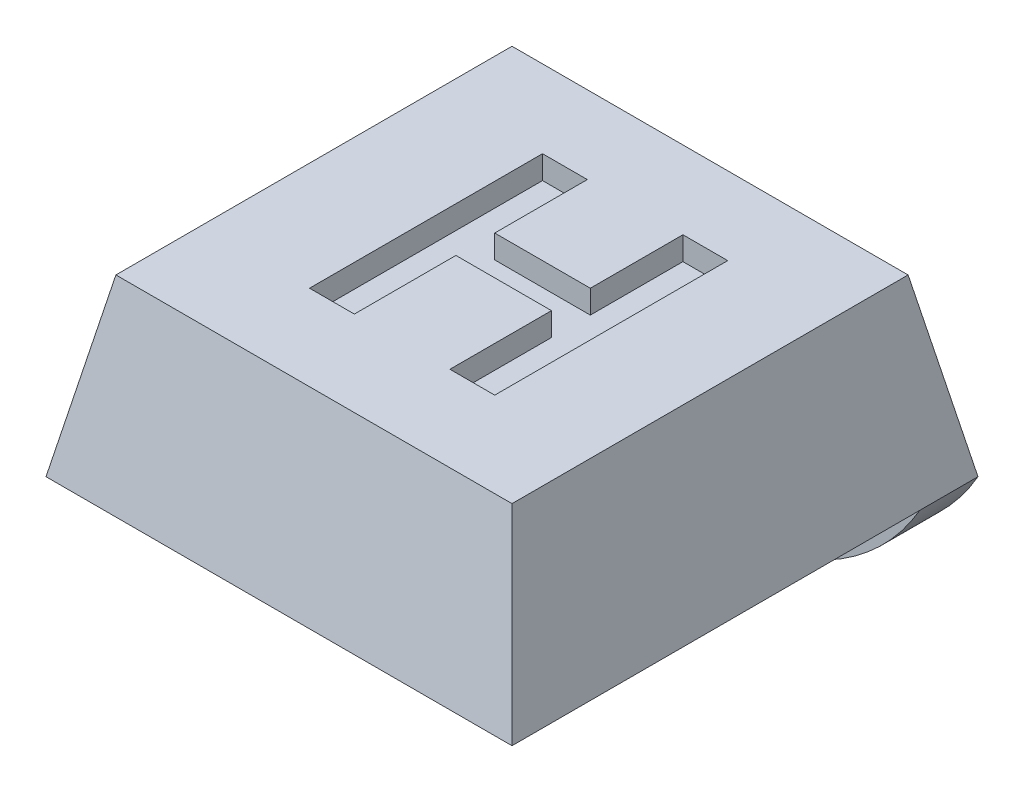
from build123d import *

# Parameters (mm, degrees)
SKETCH1_W               = 8
SKETCH1_H               = 8
BOSS_EXTRUDE1_DEPTH     = 3
CUT_EXTRUDE1_DEPTH      = 12.704699911
CUT_EXTRUDE1_DEPTH_BACK = 12.704699911
CUT_EXTRUDE2_DEPTH      = 11
SKETCH4_R               = 1.8
CUT_EXTRUDE3_DEPTH      = 0.8
SKETCH5_W               = 8
SKETCH5_H               = 1
BOSS_EXTRUDE2_DEPTH     = 2
FILLET1_R               = 4
CUT_EXTRUDE4_DEPTH      = 0.4


with BuildPart() as part:
    # Sketch1 → Boss-Extrude1 (new body)
    with BuildSketch(Plane(origin=(0, 0, 0), x_dir=(1, 0, 0), z_dir=(0, 1, 0))):
        with Locations((4, 4)):
            Rectangle(SKETCH1_W, SKETCH1_H)
    extrude(amount=BOSS_EXTRUDE1_DEPTH)

    # Sketch2 → Cut-Extrude1 (cut, two sides: drawn at the far end of the back side and taken through both)
    with BuildSketch(Plane.XY.offset(-CUT_EXTRUDE1_DEPTH_BACK)):
        Polygon((0, 0), (0.6, 3), (0, 3), align=None)
        Polygon((8, 0), (7.4, 3), (8, 3), align=None)
    extrude(amount=CUT_EXTRUDE1_DEPTH + CUT_EXTRUDE1_DEPTH_BACK, mode=Mode.SUBTRACT)

    # Sketch3 → Cut-Extrude2 (cut)
    with BuildSketch(Plane(origin=(0, 0, 0), x_dir=(0, 0, -1), z_dir=(1, 0, 0))):
        Polygon((0, 0), (0.6, 3), (0, 3), align=None)
        Polygon((8, 3), (7.4, 3), (8, 0), align=None)
    extrude(amount=CUT_EXTRUDE2_DEPTH, mode=Mode.SUBTRACT)

    # Sketch4 → Cut-Extrude3 (cut)
    with BuildSketch(Plane.XZ):
        with Locations(Location((4, -3.75, 0), (0, 0, 270))):
            Circle(SKETCH4_R)
    extrude(amount=-CUT_EXTRUDE3_DEPTH, mode=Mode.SUBTRACT)

    # Sketch5 → Boss-Extrude2 (add)
    with BuildSketch(Plane.XZ):
        with Locations((4, -7.5)):
            Rectangle(SKETCH5_W, SKETCH5_H)
    extrude(amount=BOSS_EXTRUDE2_DEPTH)

    # Fillet1
    # the kernel refuses this fillet: 4 mm, written as the material it takes off along each edge
    with BuildSketch(Plane(origin=(8, -2, -16.660254038), x_dir=(0, 1, 0), z_dir=(0, 0, 1)), Plane(origin=(0, -2, 1.660254038), x_dir=(0, 1, 0), z_dir=(0, 0, -1))) as fillet1_piece_1:
        with BuildLine():
            CenterArc((4, 3.464101615), FILLET1_R, 180, 60)
            Line((0, 3.464101615), (-0.08, 3.464101615))
            Line((-0.08, 3.464101615), (-0.08, 0))
            Line((-0.08, 0), (0, -0.08))
            ThreePointArc((0, -0.08), (1, -0.08), (1.96, -0.069282032))
            Line((1.96, -0.069282032), (2, 0))
        make_face()
    extrude(amount=18.320508076, mode=Mode.SUBTRACT)

    # Sketch6 → Cut-Extrude4 (cut)
    with BuildSketch(Plane(origin=(0, 3, 0), x_dir=(1, 0, 0), z_dir=(0, 1, 0))):
        Polygon((2.459405501, 2.064543337), (2.459405501, 6.064543337), (3.22863627, 6.064543337), (3.22863627, 4.474799747), (4.869661911, 4.474799747), (4.869661911, 6.064543337), (5.63889268, 6.064543337), (5.63889268, 2.064543337), (4.869661911, 2.064543337), (4.869661911, 3.80813308), (3.22863627, 3.80813308), (3.22863627, 2.064543337), align=None)
    extrude(amount=-CUT_EXTRUDE4_DEPTH, mode=Mode.SUBTRACT)


solid = part.part
